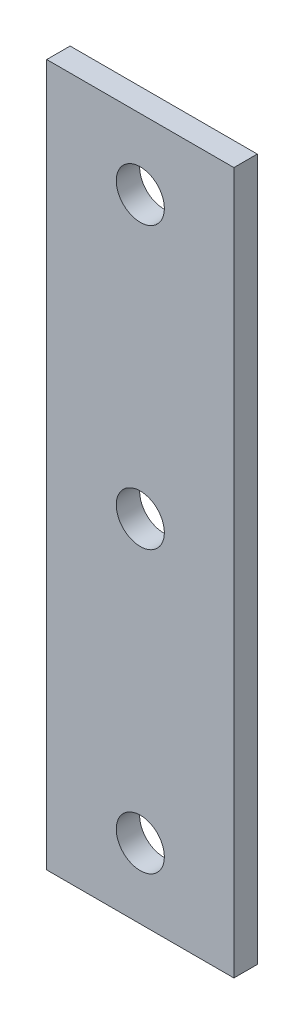
from build123d import *

# Parameters (mm, degrees)
SKETCH2_W             = 12.7
SKETCH2_H             = 47.625
BASE_FLANGE1_DEPTH    = 1.5875
F_4_CLEARANCE_HOLE1_D = 3.2639


# Sheet-metal steps are written as plain solids
with BuildPart() as part:
    # Sketch2 → Base-Flange1 (new body)
    with BuildSketch(Plane.XY):
        Rectangle(SKETCH2_W, SKETCH2_H)
    extrude(amount=-BASE_FLANGE1_DEPTH)

    # #4 Clearance Hole1 (through all)
    with Locations(Plane.XY):
        with Locations((0, 0), (0, 19.05), (0, -19.05)):
            Hole(F_4_CLEARANCE_HOLE1_D / 2)


solid = part.part
